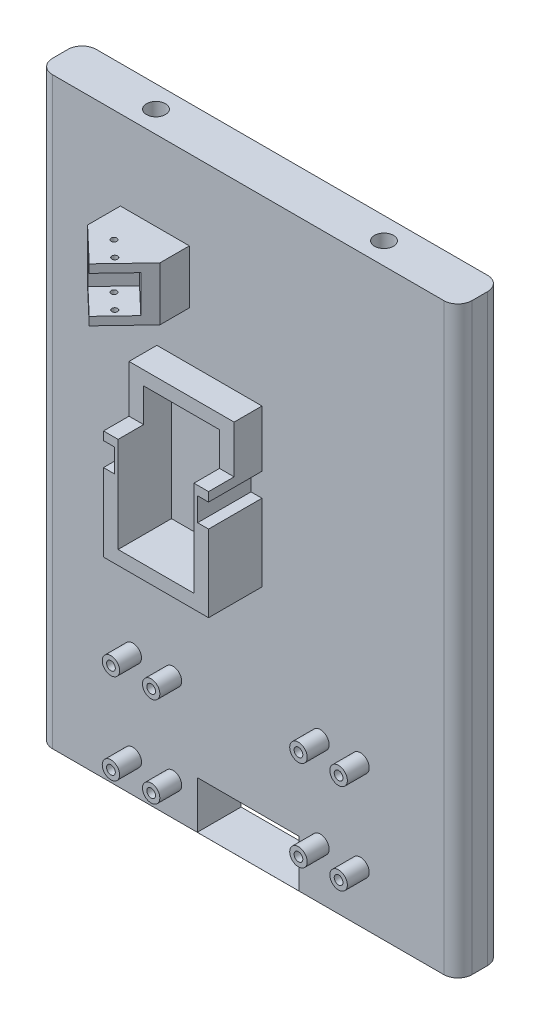
from build123d import *
from OCP.BRepAlgoAPI import BRepAlgoAPI_Cut
from OCP.TopTools import TopTools_ListOfShape

# Parameters (mm, degrees)
SKETCH1_W               = 101.6
SKETCH1_H               = 203.2
BOSS_EXTRUDE1_DEPTH     = 7.62
FILLET1_R               = 6.35
FILLET2_R               = 6.35
FILLET3_R               = 6.35
FILLET4_R               = 6.35
SKETCH5_W               = 36.576
SKETCH5_H               = 54.5338
SKETCH5_W_2             = 26.416
SKETCH5_H_2             = 44.8818
BOSS_EXTRUDE2_DEPTH     = 18.5928
SKETCH7_W               = 24
SKETCH7_H               = 18.7
BOSS_EXTRUDE3_DEPTH     = 22.86
CUT_EXTRUDE3_DEPTH      = 229.331731479
CUT_EXTRUDE3_DEPTH_BACK = 229.331731479
SKETCH9_W               = 3.81
SKETCH9_H               = 8.128
SKETCH23_W              = 8.89
SKETCH23_H              = 16.51
CUT_EXTRUDE9_DEPTH      = 213.869730765
CUT_EXTRUDE5_DEPTH      = 20.574
CUT_EXTRUDE6_DEPTH      = 6.477
SKETCH14_R              = 3.0226
SKETCH14_R_2            = 1.524
BOSS_EXTRUDE4_DEPTH     = 7.62
SKETCH16_R              = 3.048
SKETCH16_R_2            = 1.524
BOSS_EXTRUDE5_DEPTH     = 7.62
SKETCH18_R              = 1
CUT_EXTRUDE7_DEPTH      = 18.7
SKETCH22_W              = 35.382112174
SKETCH22_H              = 16.50159333
CUT_EXTRUDE8_DEPTH      = 229.331731479
BOSS_EXTRUDE6_START     = -186.698407
SKETCH25_W              = 146.05
SKETCH25_H              = 15.24
BOSS_EXTRUDE6_DEPTH     = 203.208407
SKETCH2_R               = 3.302
CUT_EXTRUDE1_DEPTH      = 240.906893537
FILLET5_R               = 4.92
SKETCH26_W              = 35.382112174
SKETCH26_H              = 16.50159333
CUT_EXTRUDE10_DEPTH     = 240.051145906


with BuildPart() as part:
    # Sketch1 → Boss-Extrude1 (new, symmetric)
    with BuildSketch(Plane.XY):
        with Locations((50.8, 101.6)):
            Rectangle(SKETCH1_W, SKETCH1_H)
    extrude(amount=BOSS_EXTRUDE1_DEPTH, both=True)

    # Fillet1
    fillet1_edges = [part.edges().sort_by_distance(p)[0] for p in [
        (101.6, 101.6, 7.62),
    ]]
    fillet(fillet1_edges, radius=FILLET1_R)

    # Fillet2
    fillet2_edges = [part.edges().sort_by_distance(p)[0] for p in [
        (101.6, 101.6, -7.62),
    ]]
    fillet(fillet2_edges, radius=FILLET2_R)

    # Fillet3
    fillet3_edges = [part.edges().sort_by_distance(p)[0] for p in [
        (0, 101.6, -7.62),
    ]]
    fillet(fillet3_edges, radius=FILLET3_R)

    # Fillet4
    fillet4_edges = [part.edges().sort_by_distance(p)[0] for p in [
        (0, 101.6, 7.62),
    ]]
    fillet(fillet4_edges, radius=FILLET4_R)

    # Sketch5 → Boss-Extrude2 (add)
    with BuildSketch(Plane.XY.offset(7.62)):
        with Locations((37.338, 112.5093)):
            Rectangle(SKETCH5_W, SKETCH5_H)
        with Locations((37.338, 112.5093)):
            Rectangle(SKETCH5_W_2, SKETCH5_H_2, mode=Mode.SUBTRACT)
    extrude(amount=BOSS_EXTRUDE2_DEPTH)

    # Sketch7 → Boss-Extrude3 (add)
    with BuildSketch(Plane.XY.offset(7.62)):
        with Locations((18.35, 166.068)):
            Rectangle(SKETCH7_W, SKETCH7_H)
    extrude(amount=BOSS_EXTRUDE3_DEPTH)

    # Sketch9 → Cut-Extrude3 (cut, two sides: drawn at the far end of the back side and taken through both)
    with BuildSketch(Plane.XY.offset(7.62).offset(-CUT_EXTRUDE3_DEPTH_BACK)):
        with Locations((53.721, 116.038476249)):
            Rectangle(SKETCH9_W, SKETCH9_H)
        with Locations((20.955, 116.283446292)):
            Rectangle(SKETCH9_W, SKETCH9_H)
    extrude(amount=CUT_EXTRUDE3_DEPTH + CUT_EXTRUDE3_DEPTH_BACK, mode=Mode.SUBTRACT)

    # Sketch23 → Cut-Extrude9 (cut, through all)
    with BuildSketch(Plane(origin=(55.626, 0, 0), x_dir=(0, 0, -1), z_dir=(1, 0, 0))):
        with Locations((-21.7678, 131.5212)):
            Rectangle(SKETCH23_W, SKETCH23_H)
    extrude(amount=-CUT_EXTRUDE9_DEPTH, mode=Mode.SUBTRACT)

    # Sketch12 → Cut-Extrude5 (cut)
    with BuildSketch(Plane(origin=(0, 175.418, 0), x_dir=(1, 0, 0), z_dir=(0, 1, 0))):
        Polygon((18.35, -30.48), (6.35, -19.05), (6.35, -30.48), align=None)
        Polygon((30.35, -17.881574803), (18.35, -30.48), (30.35, -30.48), align=None)
    extrude(amount=-CUT_EXTRUDE5_DEPTH, mode=Mode.SUBTRACT)

    # Sketch13 → Cut-Extrude6 (cut, symmetric)
    with BuildSketch(Plane(origin=(0, 166.068, 0), x_dir=(-1, 0, 0), z_dir=(0, -1, 0))):
        Polygon((-18.35, -30.48), (-27.109194739, -21.283995024), (-17.913189764, -12.524800285), (-9.153995024, -21.720805261), align=None)
    extrude(amount=CUT_EXTRUDE6_DEPTH, both=True, mode=Mode.SUBTRACT)

    # Sketch14 → Boss-Extrude4 (add)
    # profile 1 of 4: a face of its own
    with BuildSketch(Plane.XY.offset(7.62)):
        with Locations(Location((10.668, 42.83, 0), (0, 0, 180))):
            Circle(SKETCH14_R)
        with Locations(Location((10.668, 42.83, 0), (0, 0, 180))):
            Circle(SKETCH14_R_2, mode=Mode.SUBTRACT)
    # profile 2 of 4: a face of its own
    with BuildSketch(Plane.XY.offset(7.62)):
        with Locations(Location((24.668, 42.83, 0), (0, 0, 180))):
            Circle(SKETCH14_R)
        with Locations(Location((24.668, 42.83, 0), (0, 0, 180))):
            Circle(SKETCH14_R_2, mode=Mode.SUBTRACT)
    # profile 3 of 4: a face of its own
    with BuildSketch(Plane.XY.offset(7.62)):
        with Locations(Location((24.668, 11.43, 0), (0, 0, 180))):
            Circle(SKETCH14_R)
        with Locations(Location((24.668, 11.43, 0), (0, 0, 180))):
            Circle(SKETCH14_R_2, mode=Mode.SUBTRACT)
    # profile 4 of 4: a face of its own
    with BuildSketch(Plane.XY.offset(7.62)):
        with Locations(Location((10.668, 11.43, 0), (0, 0, 180))):
            Circle(SKETCH14_R)
        with Locations(Location((10.668, 11.43, 0), (0, 0, 180))):
            Circle(SKETCH14_R_2, mode=Mode.SUBTRACT)
    extrude(amount=BOSS_EXTRUDE4_DEPTH)

    # Sketch16 → Boss-Extrude5 (add)
    # profile 1 of 4: a face of its own
    with BuildSketch(Plane.XY.offset(7.62)):
        with Locations(Location((75.946, 49.3522, 0), (0, 0, 180))):
            Circle(SKETCH16_R)
        with Locations(Location((75.946, 49.3522, 0), (0, 0, 180))):
            Circle(SKETCH16_R_2, mode=Mode.SUBTRACT)
    # profile 2 of 4: a face of its own
    with BuildSketch(Plane.XY.offset(7.62)):
        with Locations(Location((89.916, 49.3522, 0), (0, 0, 180))):
            Circle(SKETCH16_R)
        with Locations(Location((89.916, 49.3522, 0), (0, 0, 180))):
            Circle(SKETCH16_R_2, mode=Mode.SUBTRACT)
    # profile 3 of 4: a face of its own
    with BuildSketch(Plane.XY.offset(7.62)):
        with Locations(Location((75.946, 17.8562, 0), (0, 0, 180))):
            Circle(SKETCH16_R)
        with Locations(Location((75.946, 17.8562, 0), (0, 0, 180))):
            Circle(SKETCH16_R_2, mode=Mode.SUBTRACT)
    # profile 4 of 4: a face of its own
    with BuildSketch(Plane.XY.offset(7.62)):
        with Locations(Location((89.916, 17.8562, 0), (0, 0, 180))):
            Circle(SKETCH16_R)
        with Locations(Location((89.916, 17.8562, 0), (0, 0, 180))):
            Circle(SKETCH16_R_2, mode=Mode.SUBTRACT)
    extrude(amount=BOSS_EXTRUDE5_DEPTH)

    # Sketch18 → Cut-Extrude7 (cut)
    with BuildSketch(Plane(origin=(0, 175.418, 0), x_dir=(1, 0, 0), z_dir=(0, 1, 0))):
        with BuildLine():
            ThreePointArc((21.890396375, -24.130158564), (21.261816029, -23.201693465), (20.166301495, -23.440458191))
            Line((20.166301495, -23.440458191), (21.614491255, -24.819858937))
            ThreePointArc((21.614491255, -24.819858937), (21.818861474, -24.501578219), (21.890396375, -24.130158564))
        make_face()
        with BuildLine():
            Line((21.614491255, -24.819858937), (20.166301495, -23.440458191))
            ThreePointArc((20.166301495, -23.440458191), (20.200696001, -24.854253444), (21.614491255, -24.819858937))
        make_face()
        with Locations(Location((15.372793389, -18.87464172, 0), (0, 0, 270))):
            Circle(SKETCH18_R)
    extrude(amount=-CUT_EXTRUDE7_DEPTH, mode=Mode.SUBTRACT)

    # Sketch22 → Cut-Extrude8 (cut, through all)
    with BuildSketch(Plane.XY.offset(7.62)):
        with Locations((50.8, 8.250796665)):
            Rectangle(SKETCH22_W, SKETCH22_H)
    extrude(amount=-CUT_EXTRUDE8_DEPTH, mode=Mode.SUBTRACT)

    # Sketch25 → Boss-Extrude6 (add)
    with BuildSketch(Plane(origin=(0, 16.50159333, 0), x_dir=(-1, 0, 0), z_dir=(0, -1, 0)).offset(BOSS_EXTRUDE6_START)):
        with Locations((-50.8, 0)):
            Rectangle(SKETCH25_W, SKETCH25_H)
    extrude(amount=BOSS_EXTRUDE6_DEPTH)


with BuildPart() as cut_extrude1_tool:
    # Sketch2 → Cut-Extrude1 (new, through all)
    with BuildSketch(Plane(origin=(0, 203.2, 0), x_dir=(1, 0, 0), z_dir=(0, 1, 0))):
        with Locations(Location((11.1125, 0, 0), (0, 0, 270))):
            Circle(SKETCH2_R)
        with Locations(Location((90.4875, 0, 0), (0, 0, 270))):
            Circle(SKETCH2_R)
    extrude(amount=-CUT_EXTRUDE1_DEPTH)


with BuildPart() as part_1:
    add(part.part)

    # Cut-Extrude1: cut by cut_extrude1_tool, with a tolerance
    cut_extrude1_stock = TopTools_ListOfShape()
    cut_extrude1_stock.Append(part_1.part.wrapped)
    cut_extrude1_tools = TopTools_ListOfShape()
    cut_extrude1_tools.Append(cut_extrude1_tool.part.wrapped)
    cut_extrude1_cut = BRepAlgoAPI_Cut()
    cut_extrude1_cut.SetArguments(cut_extrude1_stock)
    cut_extrude1_cut.SetTools(cut_extrude1_tools)
    cut_extrude1_cut.SetFuzzyValue(0.00001)
    cut_extrude1_cut.Build()
    add(Compound.cast(cut_extrude1_cut.Shape()).solids(), mode=Mode.REPLACE)

    # Fillet5
    fillet5_edges = [part_1.edges().sort_by_distance(p)[0] for p in [
        (-22.225, 101.59579683, 7.62),
        (-22.225, 101.59579683, -7.62),
        (123.825, 101.59579683, 7.62),
        (123.825, 101.59579683, -7.62),
    ]]
    fillet(fillet5_edges, radius=FILLET5_R)

    # Sketch26 → Cut-Extrude10 (cut, through all)
    with BuildSketch(Plane.XY.offset(7.62)):
        with Locations((50.8, 8.250796665)):
            Rectangle(SKETCH26_W, SKETCH26_H)
    extrude(amount=-CUT_EXTRUDE10_DEPTH, mode=Mode.SUBTRACT)


solid = part_1.part
